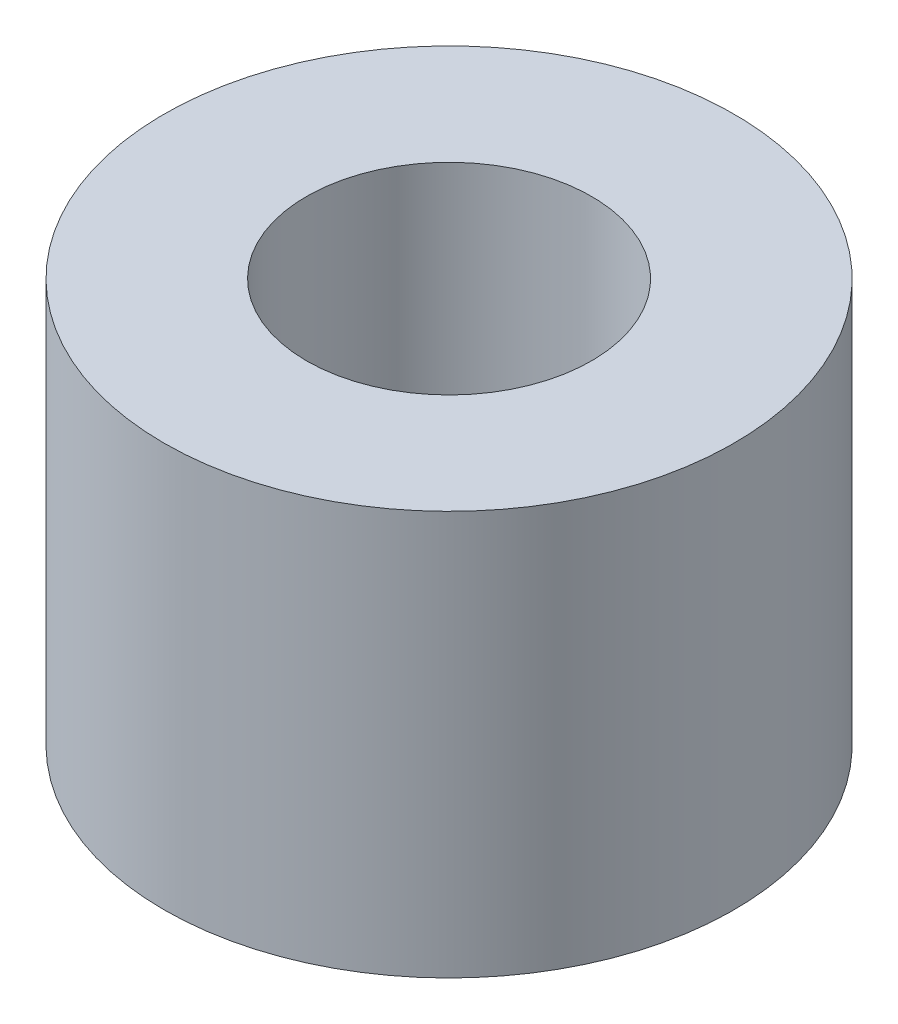
from build123d import *

# Parameters (mm, degrees)
SKETCH1_R           = 10
SKETCH1_R_2         = 5
BOSS_EXTRUDE1_DEPTH = 14.18


with BuildPart() as part:
    # Sketch1 → Boss-Extrude1 (new body)
    with BuildSketch(Plane(origin=(0, 0, 0), x_dir=(1, 0, 0), z_dir=(0, 1, 0))):
        Circle(SKETCH1_R)
        Circle(SKETCH1_R_2, mode=Mode.SUBTRACT)
    extrude(amount=BOSS_EXTRUDE1_DEPTH)


solid = part.part
